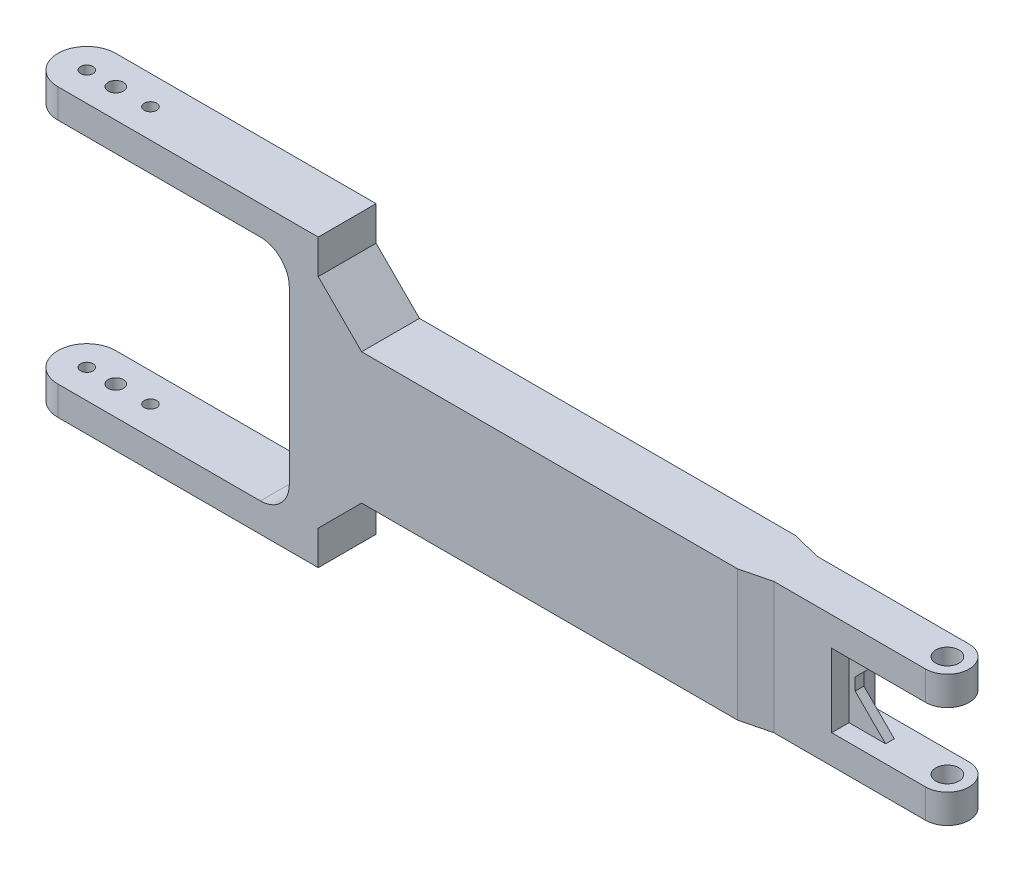
from build123d import *

# Parameters (mm, degrees)
SKETCH_2_W          = 165
SKETCH_2_H          = 45.3
EXTRUDE_1_DEPTH     = 10
EXTRUDE_2_DEPTH     = 7.5
CHAMFER_1_SIZE      = 20
CHAMFER_1_SIZE_2    = 5
CHAMFER_2_SIZE      = 5
CHAMFER_2_SIZE_2    = 20
EXTRUDE_3_DEPTH     = 1.5
CHAMFER_3_SIZE      = 3
CUT_EXTRUDE_1_DEPTH = 293.448286027
CUT_EXTRUDE_2_DEPTH = 285.483079462
CHAMFER_4_SIZE      = 15
FILLET_1_R          = 10


with BuildPart() as part:
    # 草图2 → 凸台-拉伸1 (new, symmetric)
    with BuildSketch(Plane.XY):
        with Locations((-92.5, 0)):
            Rectangle(SKETCH_2_W, SKETCH_2_H)
        Polygon((-275, 49.5), (-275, 39.5), (-185, 39.5), (-185, -39.5), (-275, -39.5), (-275, -49.5), (-175, -49.5), (-175, 49.5), align=None)
    extrude(amount=EXTRUDE_1_DEPTH, both=True)

    # 草图2<3> → 凸台-拉伸2 (add, symmetric)
    with BuildSketch(Plane.XY):
        Polygon((40, -22.65), (40, -12.65), (0, -12.65), (0, 12.65), (40, 12.65), (40, 22.65), (-10, 22.65), (-10, -22.65), align=None)
    extrude(amount=EXTRUDE_2_DEPTH, both=True)

    # 倒角1
    # the kernel refuses this chamfer: 20, 5 mm, written as the material it takes off along each edge
    with BuildSketch(Plane(origin=(-10, -74.592549995, 10), x_dir=(-0.9999563942249224, 0, 0.00933861064031752), z_dir=(0, 1, 0))) as chamfer_1_piece_1_section:
        Polygon((CHAMFER_1_SIZE * 0.999956394225, -CHAMFER_1_SIZE * 0.00933861064032), (-CHAMFER_1_SIZE_2 * 0.00933861064032, -CHAMFER_1_SIZE_2 * 0.999956394225), (0, 0), align=None)
    chamfer_1_piece_1 = extrude(amount=149.185099991, mode=Mode.PRIVATE)
    chamfer_1_piece_1 = split(chamfer_1_piece_1, bisect_by=Plane(origin=(-18.245866107, 0, 7.5), z_dir=(0, 0, 1)), keep=Keep.TOP, mode=Mode.PRIVATE)
    add(chamfer_1_piece_1, mode=Mode.SUBTRACT)

    # 倒角2
    # the kernel refuses this chamfer: 20, 5 mm, written as the material it takes off along each edge
    with BuildSketch(Plane(origin=(-10, -74.592549995, -10), x_dir=(0.14778356633657133, 0, 0.9890197255468893), z_dir=(0, 1, 0))) as chamfer_2_piece_1_section:
        Polygon((CHAMFER_2_SIZE * 0.989019725547, -CHAMFER_2_SIZE * 0.147783566337), (-CHAMFER_2_SIZE_2 * 0.147783566337, -CHAMFER_2_SIZE_2 * 0.989019725547), (0, 0), align=None)
    chamfer_2_piece_1 = extrude(amount=149.185099991, mode=Mode.PRIVATE)
    chamfer_2_piece_1 = split(chamfer_2_piece_1, bisect_by=Plane(origin=(-18.245866107, 0, -7.5), z_dir=(0, 0, -1)), keep=Keep.TOP, mode=Mode.PRIVATE)
    add(chamfer_2_piece_1, mode=Mode.SUBTRACT)

    # 草图2<5> → 凸台-拉伸3 (add, symmetric)
    with BuildSketch(Plane.XY):
        Polygon((12.65, 12.65), (0, 12.65), (0, 0), align=None)
        Polygon((12.65, -12.65), (0, 0), (0, -12.65), align=None)
    extrude(amount=EXTRUDE_3_DEPTH, both=True)

    # 倒角3
    chamfer_3_edges = [part.edges().sort_by_distance(p)[0] for p in [
        (0, 0, 0),
    ]]
    chamfer(chamfer_3_edges, length=CHAMFER_3_SIZE)

    # 草图3 → 切除-拉伸1 (cut, through all)
    with BuildSketch(Plane(origin=(0, 49.5, 0), x_dir=(1, 0, 0), z_dir=(0, 1, 0))):
        with BuildLine():
            ThreePointArc((-275, 0), (-272.071067812, 7.071067812), (-265, 10))
            Line((-265, 10), (-275, 10))
            Line((-275, 10), (-275, 0))
        make_face()
        with BuildLine():
            Line((-275, -10), (-265, -10))
            ThreePointArc((-265, -10), (-272.071067812, -7.071067812), (-275, 0))
            Line((-275, 0), (-275, -10))
        make_face()
        with BuildLine():
            ThreePointArc((-267.15, 0), (-265, -2.15), (-262.85, 0))
            Line((-262.85, 0), (-267.15, 0))
        make_face()
        with BuildLine():
            Line((-267.15, 0), (-262.85, 0))
            ThreePointArc((-262.85, 0), (-265, 2.15), (-267.15, 0))
        make_face()
        with BuildLine():
            ThreePointArc((-257.65, 0), (-255, -2.65), (-252.35, 0))
            Line((-252.35, 0), (-257.65, 0))
        make_face()
        with BuildLine():
            Line((-257.65, 0), (-252.35, 0))
            ThreePointArc((-252.35, 0), (-255, 2.65), (-257.65, 0))
        make_face()
        with BuildLine():
            ThreePointArc((-245.15, 0), (-243, -2.15), (-240.85, 0))
            Line((-240.85, 0), (-245.15, 0))
        make_face()
        with BuildLine():
            Line((-245.15, 0), (-240.85, 0))
            ThreePointArc((-240.85, 0), (-243, 2.15), (-245.15, 0))
        make_face()
    extrude(amount=-CUT_EXTRUDE_1_DEPTH, mode=Mode.SUBTRACT)

    # 草图4 → 切除-拉伸2 (cut, through all)
    with BuildSketch(Plane(origin=(0, 22.65, 0), x_dir=(1, 0, 0), z_dir=(0, 1, 0))):
        with BuildLine():
            ThreePointArc((28.5, 0), (32.5, -4), (36.5, 0))
            Line((36.5, 0), (28.5, 0))
        make_face()
        with BuildLine():
            Line((28.5, 0), (36.5, 0))
            ThreePointArc((36.5, 0), (32.5, 4), (28.5, 0))
        make_face()
        with BuildLine():
            ThreePointArc((32.5, 7.5), (37.803300859, 5.303300859), (40, 0))
            Line((40, 0), (40, 7.5))
            Line((40, 7.5), (32.5, 7.5))
        make_face()
        with BuildLine():
            Line((40, -7.5), (40, 0))
            ThreePointArc((40, 0), (37.80330088, -5.303300838), (32.500000061, -7.5))
            Line((32.500000061, -7.5), (40, -7.5))
        make_face()
    extrude(amount=-CUT_EXTRUDE_2_DEPTH, mode=Mode.SUBTRACT)

    # 倒角4
    chamfer_4_edges = [part.edges().sort_by_distance(p)[0] for p in [
        (-175, -22.65, 0),
        (-175, 22.65, 0),
    ]]
    chamfer(chamfer_4_edges, length=CHAMFER_4_SIZE)

    # 圆角1
    fillet_1_edges = [part.edges().sort_by_distance(p)[0] for p in [
        (-185, -39.5, 0),
        (-185, 39.5, 0),
    ]]
    fillet(fillet_1_edges, radius=FILLET_1_R)


solid = part.part
